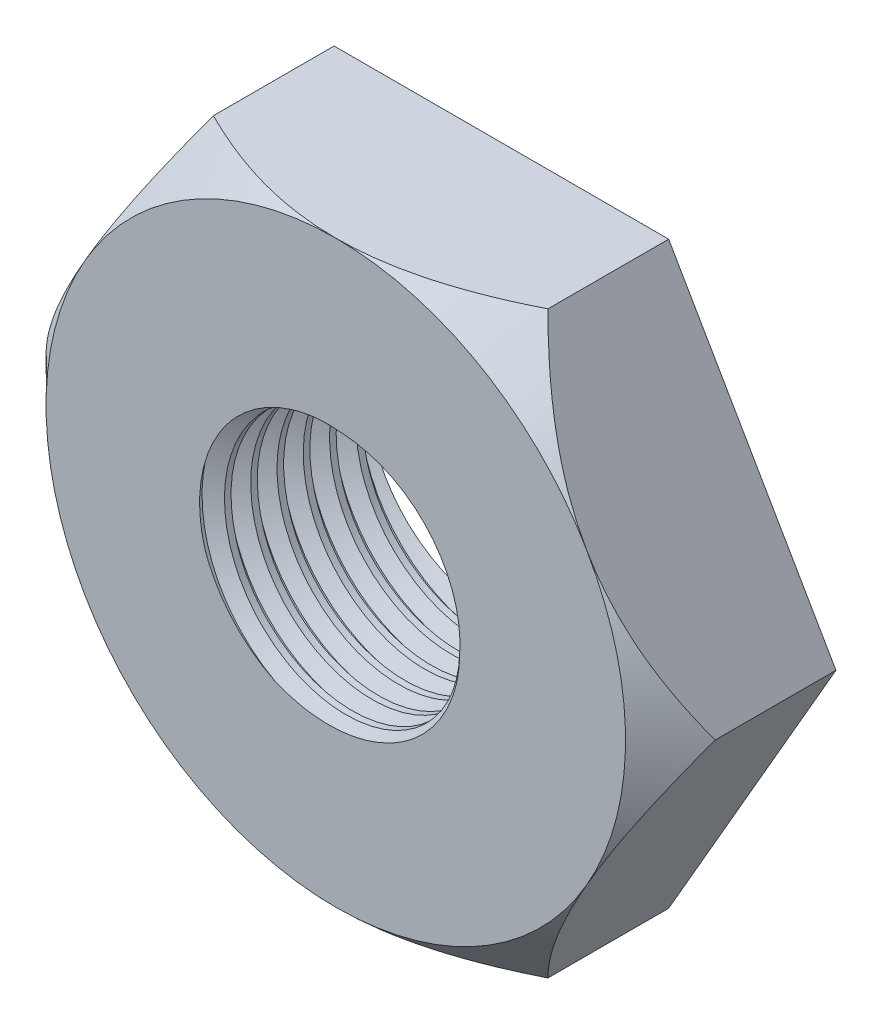
from build123d import *

# Parameters (mm, degrees)
BOSS_EXTRUDE1_DEPTH = 5
CUT_EXTRUDE3_START  = 5
SKETCH3_OUTSIDE_W   = 119.682
SKETCH3_OUTSIDE_H   = 114.268
SKETCH3_OUTSIDE_R   = 17.5
CUT_EXTRUDE3_DEPTH  = 33.195281453
CUT_EXTRUDE3_DRAFT  = -45
SKETCH4_R           = 7.5
CUT_EXTRUDE6_DEPTH  = 25
THREAD9_PITCH       = 1.5875


with BuildPart() as part:
    # Sketch2 → Boss-Extrude1 (new, symmetric)
    with BuildSketch(Plane.XY):
        Polygon((20.207259422, 0), (10.103629711, 17.5), (-10.103629711, 17.5), (-20.207259422, 0), (-10.103629711, -17.5), (10.103629711, -17.5), align=None)
    extrude(amount=BOSS_EXTRUDE1_DEPTH, both=True)


with BuildPart() as cut_extrude3_tool:
    # Sketch3 outside → Cut-Extrude3 (with draft: the straight prism first)
    with BuildSketch(Plane.XY.offset(CUT_EXTRUDE3_START)):
        Rectangle(SKETCH3_OUTSIDE_W, SKETCH3_OUTSIDE_H)
        Circle(SKETCH3_OUTSIDE_R, mode=Mode.SUBTRACT)
    extrude(amount=-CUT_EXTRUDE3_DEPTH)
    # Cut-Extrude3: the draft: its side faces are tilted about the plane it starts from
    cut_extrude3_sides = [cut_extrude3_tool.faces().sort_by_distance(p)[0] for p in [
        (0, -57.134, -11.597640727),
        (59.841, 0, -11.597640727),
        (0, 57.134, -11.597640727),
        (-59.841, 0, -11.597640727),
        (-17.5, 0, -11.597640727),
    ]]
    draft(cut_extrude3_sides, Plane.XY.offset(CUT_EXTRUDE3_START), CUT_EXTRUDE3_DRAFT)


with BuildPart() as part_1:
    add(part.part)

    # Cut-Extrude3: cut by cut_extrude3_tool
    add(cut_extrude3_tool.part, mode=Mode.SUBTRACT)

    # Sketch4 → Cut-Extrude6 (cut, symmetric)
    with BuildSketch(Plane.XY):
        Circle(SKETCH4_R)
    extrude(amount=CUT_EXTRUDE6_DEPTH, both=True, mode=Mode.SUBTRACT)

    # Thread9: the profile of Thread Profile11 profile screwed along a right-hand helix of 7.559055 turns, 8 arcs to a turn; built about Z, then put on its axis
    thread9_z = Axis((0, 0, 0), (0, 0, 1))
    thread9_corners = [(7.4997, 0, -0.000173205), (8.359259577, 0, 0.496093748), (8.359259577, 0, 0.694531248), (7.4997, 0, 1.190798201)]
    with BuildLine(mode=Mode.PRIVATE) as thread9_profile:
        Line(thread9_corners[0], thread9_corners[1])
        Line(thread9_corners[1], thread9_corners[2])
        Line(thread9_corners[2], thread9_corners[3])
        Line(thread9_corners[3], thread9_corners[0])
    thread9_cap = Face(thread9_profile.wire())
    thread9_turn_angles = [0, 22.5, 45, 67.5, 90, 112.5, 135, 157.5, 180, 202.5, 225, 247.5, 270, 292.5, 315, 337.5, 360]
    thread9_turn_weights = [1, 0.9238795325112867, 1, 0.9238795325112867, 1, 0.9238795325112867, 1, 0.9238795325112867, 1, 0.9238795325112867, 1, 0.9238795325112867, 1, 0.9238795325112867, 1, 0.9238795325112867, 1]
    thread9_turn_rails = [Edge.make_bspline([Vector(p[0], p[1], 0).rotate(thread9_z, thread9_turn_angles[k]) / thread9_turn_weights[k] + Vector(0, 0, p[2] + THREAD9_PITCH * thread9_turn_angles[k] / 360) for k in range(17)], [0, 0, 0, 1, 1, 2, 2, 3, 3, 4, 4, 5, 5, 6, 6, 7, 7, 8, 8, 8], 2, thread9_turn_weights) for p in thread9_corners]
    thread9_turn_sides = [Face.make_surface_from_curves(thread9_turn_rails[p[0]], thread9_turn_rails[p[1]]) for p in [(0, 1), (1, 2), (2, 3), (3, 0)]]
    thread9_last_angles = [2520, 2542.5, 2565, 2587.5, 2610, 2632.5, 2655, 2677.5, 2700, 2710.62992126, 2721.25984252]
    thread9_last_weights = [1, 0.9238795325112867, 1, 0.9238795325112867, 1, 0.9238795325112867, 1, 0.9238795325112867, 1, 0.9828391512194234, 1]
    thread9_last_rails = [Edge.make_bspline([Vector(p[0], p[1], 0).rotate(thread9_z, thread9_last_angles[k]) / thread9_last_weights[k] + Vector(0, 0, p[2] + THREAD9_PITCH * thread9_last_angles[k] / 360) for k in range(11)], [0, 0, 0, 1, 1, 2, 2, 3, 3, 4, 4, 5, 5, 5], 2, thread9_last_weights) for p in thread9_corners]
    thread9_last_sides = [Face.make_surface_from_curves(thread9_last_rails[p[0]], thread9_last_rails[p[1]]) for p in [(0, 1), (1, 2), (2, 3), (3, 0)]]
    thread9 = Plane(origin=(0, 0, 7), x_dir=(-1, 0, 0), z_dir=(0, 0, -1)) * Solid(Shell([*[p.moved(Location((0, 0, THREAD9_PITCH * i))) for i in range(7) for p in thread9_turn_sides], *thread9_last_sides, thread9_cap, thread9_cap.rotate(thread9_z, 2721.25984252).moved(Location((0, 0, THREAD9_PITCH * 2721.25984252 / 360)))]))
    add(thread9, mode=Mode.SUBTRACT)


solid = part_1.part
